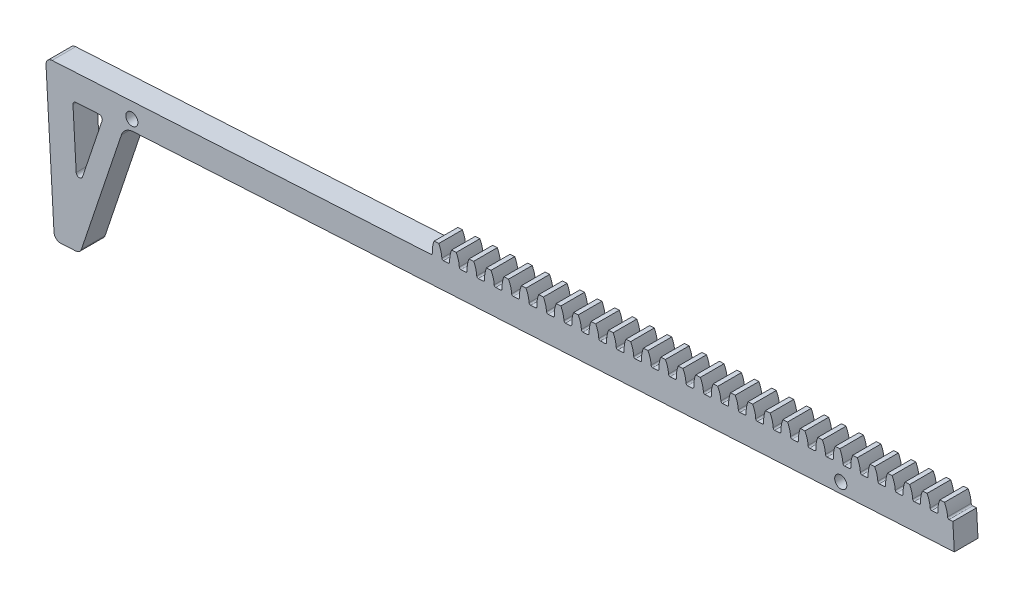
from build123d import *

# Parameters (mm, degrees)
SKETCH1_R                = 24.69999886
SKETCH1_R_2              = 23.39999892
SKETCH1_R_3              = 21.579999004
BOSS_EXTRUDE1_DEPTH      = 2.821
SKETCH8_R                = 7.9375
SKETCH8_R_2              = 1.7526
CUT_EXTRUDE1_DEPTH       = 36.383782321
CUT_EXTRUDE2_DEPTH       = 36.383782321
FILLET3_R                = 0.389999982
CIRPATTERN3_COUNT        = 36
FILLET3_OF_CIRPATTERN3_R = 0.389999982
SKETCH9_R                = 2.994
CUT_EXTRUDE3_DEPTH       = 1.292000064
CHAMFER1_SIZE            = 0.2
BOSS_EXTRUDE2_DEPTH      = 5.842
SKETCH12_R               = 42.047341091
CUT_EXTRUDE4_DEPTH       = 5.642
BOSS_EXTRUDE3_DEPTH      = 5.842
CUT_EXTRUDE5_DEPTH       = 181.609919335
BOSS_EXTRUDE4_DEPTH      = 5.842
FILLET4_R                = 0.79375
FILLET5_R                = 3.175
FILLET6_R                = 1.5875
SKETCH16_R               = 1.5
CUT_EXTRUDE6_DEPTH       = 131.491659985


with BuildPart() as part:
    # Sketch1 → Boss-Extrude1 (new, symmetric)
    # profile 1 of 3: a face of its own
    with BuildSketch(Plane.XY):
        with Locations(Location((0, 0, 0), (0, 0, 180))):
            Circle(SKETCH1_R)
        Circle(SKETCH1_R_2, mode=Mode.SUBTRACT)
    # profile 2 of 3: a face of its own
    with BuildSketch(Plane.XY):
        Circle(SKETCH1_R_2)
        Circle(SKETCH1_R_3, mode=Mode.SUBTRACT)
    # profile 3 of 3: a face of its own
    with BuildSketch(Plane.XY):
        Circle(SKETCH1_R_3)
    extrude(amount=BOSS_EXTRUDE1_DEPTH, both=True)

    # Sketch8 → Cut-Extrude1 (cut, through all)
    with BuildSketch(Plane.XY.offset(2.821)):
        Circle(SKETCH8_R)
        with Locations((0, 13.5)):
            Circle(SKETCH8_R_2)
        with Locations((11.691342951, 6.75)):
            Circle(SKETCH8_R_2)
        with Locations((11.691342951, -6.75)):
            Circle(SKETCH8_R_2)
        with Locations((0, -13.5)):
            Circle(SKETCH8_R_2)
        with Locations((-11.691342951, -6.75)):
            Circle(SKETCH8_R_2)
        with Locations((-11.691342951, 6.75)):
            Circle(SKETCH8_R_2)
    extrude(amount=-CUT_EXTRUDE1_DEPTH, mode=Mode.SUBTRACT)

    # Sketch5 → Cut-Extrude2 (cut, through all)
    with BuildSketch(Plane(origin=(0, 0, 2.821), x_dir=(0.9995316301484097, -0.0306026197058779, 0), z_dir=(0, 0, 1))):
        with BuildLine():
            ThreePointArc((-2.239902489, 25.602202605), (-1.137864495, 23.712913221), (-0.70785597, 21.568386517))
            ThreePointArc((-0.70785597, 21.568386517), (0, 21.579999004), (0.70785597, 21.568386517))
            ThreePointArc((0.70785597, 21.568386517), (1.137864495, 23.712913221), (2.239902489, 25.602202605))
            ThreePointArc((2.239902489, 25.602202605), (0, 25.69999886), (-2.239902489, 25.602202605))
        make_face()
    cut_extrude2 = extrude(amount=-CUT_EXTRUDE2_DEPTH, mode=Mode.SUBTRACT)

    # Fillet3
    fillet3_edges = [part.edges().sort_by_distance(p)[0] for p in [
        (-0.047475301, 21.579946782, 0),
        (1.367573561, 21.536622288, 0),
    ]]
    fillet(fillet3_edges, radius=FILLET3_R)

    # CirPattern3: Cut-Extrude2 ×36 about axis
    cirpattern3_axis = Axis((0, 0, 0), (0, 0, 1))
    for i in range(1, CIRPATTERN3_COUNT):
        add(cut_extrude2.rotate(cirpattern3_axis, i * 360 / CIRPATTERN3_COUNT), mode=Mode.SUBTRACT)

    # Fillet3 of CirPattern3
    fillet3_of_cirpattern3_edges = [part.edges().sort_by_distance(p)[0] for p in [
        (-3.794072477, 21.243854901, 0),
        (-2.392998167, 21.446909259, 0),
        (-7.425388681, 20.262279239, 0),
        (-6.080859858, 20.705542746, 0),
        (-10.831088208, 18.665044475, 0),
        (-9.583957698, 19.335048794, 0),
        (-13.9076906, 16.50068178, 0),
        (-12.795851834, 17.377069168, 0),
        (-16.56171485, 13.834954219, 0),
        (-15.618950486, 14.891096088, 0),
        (-18.712519776, 10.748858574, 0),
        (-17.967475232, 11.95266459, 0),
        (-20.294754257, 7.336164301, 0),
        (-19.770067335, 8.651057426, 0),
        (-21.2603429, 3.700564388, 0),
        (-20.971955946, 5.086592259, 0),
        (-21.579946782, -0.047475301, 0),
        (-21.536622288, 1.367573561, 0),
        (-21.243854901, -3.794072477, 0),
        (-21.446909259, -2.392998167, 0),
        (-20.262279239, -7.425388681, 0),
        (-20.705542746, -6.080859858, 0),
        (-18.665044475, -10.831088208, 0),
        (-19.335048794, -9.583957698, 0),
        (-16.50068178, -13.9076906, 0),
        (-17.377069168, -12.795851834, 0),
        (-13.834954219, -16.56171485, 0),
        (-14.891096088, -15.618950486, 0),
        (-10.748858574, -18.712519776, 0),
        (-11.95266459, -17.967475232, 0),
        (-7.336164301, -20.294754257, 0),
        (-8.651057426, -19.770067335, 0),
        (-3.700564388, -21.2603429, 0),
        (-5.086592259, -20.971955946, 0),
        (0.047475301, -21.579946782, 0),
        (-1.367573561, -21.536622288, 0),
        (3.794072477, -21.243854901, 0),
        (2.392998167, -21.446909259, 0),
        (7.425388681, -20.262279239, 0),
        (6.080859858, -20.705542746, 0),
        (10.831088208, -18.665044475, 0),
        (9.583957698, -19.335048794, 0),
        (13.9076906, -16.50068178, 0),
        (12.795851834, -17.377069168, 0),
        (16.56171485, -13.834954219, 0),
        (15.618950486, -14.891096088, 0),
        (18.712519776, -10.748858574, 0),
        (17.967475232, -11.95266459, 0),
        (20.294754257, -7.336164301, 0),
        (19.770067335, -8.651057426, 0),
        (21.2603429, -3.700564388, 0),
        (20.971955946, -5.086592259, 0),
        (21.579946782, 0.047475301, 0),
        (21.536622288, -1.367573561, 0),
        (21.243854901, 3.794072477, 0),
        (21.446909259, 2.392998167, 0),
        (20.262279239, 7.425388681, 0),
        (20.705542746, 6.080859858, 0),
        (18.665044475, 10.831088208, 0),
        (19.335048794, 9.583957698, 0),
        (16.50068178, 13.9076906, 0),
        (17.377069168, 12.795851834, 0),
        (13.834954219, 16.56171485, 0),
        (14.891096088, 15.618950486, 0),
        (10.748858574, 18.712519776, 0),
        (11.95266459, 17.967475232, 0),
        (7.336164301, 20.294754257, 0),
        (8.651057426, 19.770067335, 0),
        (3.700564388, 21.2603429, 0),
        (5.086592259, 20.971955946, 0),
    ]]
    fillet(fillet3_of_cirpattern3_edges, radius=FILLET3_OF_CIRPATTERN3_R)

    # Sketch9 → Cut-Extrude3 (cut)
    with BuildSketch(Plane.XY.offset(2.821)):
        with Locations((0, 13.5)):
            Circle(SKETCH9_R)
        with Locations((11.691342951, 6.75)):
            Circle(SKETCH9_R)
        with Locations((11.691342951, -6.75)):
            Circle(SKETCH9_R)
        with Locations((0, -13.5)):
            Circle(SKETCH9_R)
        with Locations((-11.691342951, -6.75)):
            Circle(SKETCH9_R)
        with Locations((-11.691342951, 6.75)):
            Circle(SKETCH9_R)
    extrude(amount=-CUT_EXTRUDE3_DEPTH, mode=Mode.SUBTRACT)

    # Chamfer1
    chamfer1_edges = [part.edges().sort_by_distance(p)[0] for p in [
        (-1.7526, 13.5, 1.528999936),
        (9.938742951, 6.75, 1.528999936),
        (9.938742951, -6.75, 1.528999936),
        (-1.7526, -13.5, 1.528999936),
        (-13.443942951, -6.75, 1.528999936),
        (-13.443942951, 6.75, 1.528999936),
        (-7.9375, 0, -2.821),
        (-7.9375, 0, 2.821),
    ]]
    chamfer(chamfer1_edges, length=CHAMFER1_SIZE)

    # Sketch11 → Boss-Extrude2 (add)
    with BuildSketch(Plane.XY.offset(2.821)):
        with BuildLine():
            Line((0.325173702, 21.577548959), (1.541039178, 21.646512572))
            ThreePointArc((1.541039178, 21.646512572), (1.791118876, 21.784119919), (1.880490045, 22.055207417))
            ThreePointArc((1.880490045, 22.055207417), (1.954252523, 23.484659005), (2.331981398, 24.865272508))
            ThreePointArc((2.331981398, 24.865272508), (2.905295017, 24.904486212), (3.479365733, 24.930351886))
            ThreePointArc((3.479365733, 24.930351886), (4.010785921, 23.601305111), (4.245711645, 22.189362247))
            ThreePointArc((4.245711645, 22.189362247), (4.365163046, 21.930119117), (4.629198881, 21.821672286))
            Line((4.629198881, 21.821672286), (5.845064357, 21.890635899))
            ThreePointArc((5.845064357, 21.890635899), (6.095144055, 22.028243246), (6.184515224, 22.299330744))
            ThreePointArc((6.184515224, 22.299330744), (6.258277702, 23.728782333), (6.636006577, 25.109395836))
            ThreePointArc((6.636006577, 25.109395836), (7.209320196, 25.148609539), (7.783390912, 25.174475214))
            ThreePointArc((7.783390912, 25.174475214), (8.3148111, 23.845428438), (8.549736824, 22.433485574))
            ThreePointArc((8.549736824, 22.433485574), (8.669188225, 22.174242445), (8.93322406, 22.065795613))
            Line((8.93322406, 22.065795613), (10.149089536, 22.134759226))
            ThreePointArc((10.149089536, 22.134759226), (10.399169234, 22.272366573), (10.488540403, 22.543454071))
            ThreePointArc((10.488540403, 22.543454071), (10.562302881, 23.97290566), (10.940031756, 25.353519163))
            ThreePointArc((10.940031756, 25.353519163), (11.513345375, 25.392732866), (12.087416091, 25.418598541))
            ThreePointArc((12.087416091, 25.418598541), (12.618836279, 24.089551765), (12.853762003, 22.677608901))
            ThreePointArc((12.853762003, 22.677608901), (12.973213404, 22.418365772), (13.237249239, 22.30991894))
            Line((13.237249239, 22.30991894), (14.453114715, 22.378882553))
            ThreePointArc((14.453114715, 22.378882553), (14.703194413, 22.5164899), (14.792565582, 22.787577398))
            ThreePointArc((14.792565582, 22.787577398), (14.86632806, 24.217028987), (15.244056935, 25.59764249))
            ThreePointArc((15.244056935, 25.59764249), (15.817370554, 25.636856194), (16.39144127, 25.662721868))
            ThreePointArc((16.39144127, 25.662721868), (16.922861458, 24.333675093), (17.157787182, 22.921732228))
            ThreePointArc((17.157787182, 22.921732228), (17.277238583, 22.662489099), (17.541274418, 22.554042268))
            Line((17.541274418, 22.554042268), (18.757139894, 22.62300588))
            ThreePointArc((18.757139894, 22.62300588), (19.007219592, 22.760613227), (19.096590761, 23.031700725))
            ThreePointArc((19.096590761, 23.031700725), (19.170353239, 24.461152314), (19.548082114, 25.841765817))
            ThreePointArc((19.548082114, 25.841765817), (20.121395733, 25.880979521), (20.695466449, 25.906845195))
            ThreePointArc((20.695466449, 25.906845195), (21.226886637, 24.57779842), (21.461812361, 23.165855555))
            ThreePointArc((21.461812361, 23.165855555), (21.581263762, 22.906612426), (21.845299597, 22.798165595))
            Line((21.845299597, 22.798165595), (23.061165073, 22.867129207))
            ThreePointArc((23.061165073, 22.867129207), (23.311244772, 23.004736554), (23.40061594, 23.275824052))
            ThreePointArc((23.40061594, 23.275824052), (23.474378418, 24.705275641), (23.852107293, 26.085889144))
            ThreePointArc((23.852107293, 26.085889144), (24.425420912, 26.125102848), (24.999491628, 26.150968522))
            ThreePointArc((24.999491628, 26.150968522), (25.530911816, 24.821921747), (25.76583754, 23.409978883))
            ThreePointArc((25.76583754, 23.409978883), (25.885288941, 23.150735753), (26.149324776, 23.042288922))
            Line((26.149324776, 23.042288922), (27.365190253, 23.111252534))
            ThreePointArc((27.365190253, 23.111252534), (27.615269951, 23.248859882), (27.704641119, 23.51994738))
            ThreePointArc((27.704641119, 23.51994738), (27.778403597, 24.949398968), (28.156132472, 26.330012471))
            ThreePointArc((28.156132472, 26.330012471), (28.729446091, 26.369226175), (29.303516807, 26.395091849))
            ThreePointArc((29.303516807, 26.395091849), (29.834936995, 25.066045074), (30.069862719, 23.65410221))
            ThreePointArc((30.069862719, 23.65410221), (30.18931412, 23.39485908), (30.453349955, 23.286412249))
            Line((30.453349955, 23.286412249), (31.669215432, 23.355375862))
            ThreePointArc((31.669215432, 23.355375862), (31.91929513, 23.492983209), (32.008666298, 23.764070707))
            ThreePointArc((32.008666298, 23.764070707), (32.082428776, 25.193522295), (32.460157651, 26.574135798))
            ThreePointArc((32.460157651, 26.574135798), (33.03347127, 26.613349502), (33.607541986, 26.639215176))
            ThreePointArc((33.607541986, 26.639215176), (34.138962175, 25.310168401), (34.373887898, 23.898225537))
            ThreePointArc((34.373887898, 23.898225537), (34.493339299, 23.638982407), (34.757375134, 23.530535576))
            Line((34.757375134, 23.530535576), (35.973240611, 23.599499189))
            ThreePointArc((35.973240611, 23.599499189), (36.223320309, 23.737106536), (36.312691477, 24.008194034))
            ThreePointArc((36.312691477, 24.008194034), (36.386453955, 25.437645623), (36.76418283, 26.818259126))
            ThreePointArc((36.76418283, 26.818259126), (37.337496449, 26.857472829), (37.911567165, 26.883338504))
            ThreePointArc((37.911567165, 26.883338504), (38.442987354, 25.554291728), (38.677913077, 24.142348864))
            ThreePointArc((38.677913077, 24.142348864), (38.797364478, 23.883105735), (39.061400313, 23.774658903))
            Line((39.061400313, 23.774658903), (40.27726579, 23.843622516))
            ThreePointArc((40.27726579, 23.843622516), (40.527345488, 23.981229863), (40.616716656, 24.252317361))
            ThreePointArc((40.616716656, 24.252317361), (40.690479134, 25.68176895), (41.068208009, 27.062382453))
            ThreePointArc((41.068208009, 27.062382453), (41.641521628, 27.101596156), (42.215592344, 27.127461831))
            ThreePointArc((42.215592344, 27.127461831), (42.747012533, 25.798415055), (42.981938256, 24.386472191))
            ThreePointArc((42.981938256, 24.386472191), (43.101389657, 24.127229062), (43.365425492, 24.01878223))
            Line((43.365425492, 24.01878223), (44.581290969, 24.087745843))
            ThreePointArc((44.581290969, 24.087745843), (44.831370667, 24.22535319), (44.920741836, 24.496440688))
            ThreePointArc((44.920741836, 24.496440688), (44.994504313, 25.925892277), (45.372233188, 27.30650578))
            ThreePointArc((45.372233188, 27.30650578), (45.945546807, 27.345719484), (46.519617524, 27.371585158))
            ThreePointArc((46.519617524, 27.371585158), (47.051037712, 26.042538383), (47.285963435, 24.630595518))
            ThreePointArc((47.285963435, 24.630595518), (47.405414836, 24.371352389), (47.669450671, 24.262905558))
            Line((47.669450671, 24.262905558), (48.885316148, 24.33186917))
            ThreePointArc((48.885316148, 24.33186917), (49.135395846, 24.469476517), (49.224767015, 24.740564015))
            ThreePointArc((49.224767015, 24.740564015), (49.298529493, 26.170015604), (49.676258367, 27.550629107))
            ThreePointArc((49.676258367, 27.550629107), (50.249571986, 27.589842811), (50.823642703, 27.615708485))
            ThreePointArc((50.823642703, 27.615708485), (51.355062891, 26.28666171), (51.589988614, 24.874718845))
            ThreePointArc((51.589988614, 24.874718845), (51.709440015, 24.615475716), (51.97347585, 24.507028885))
            Line((51.97347585, 24.507028885), (53.189341327, 24.575992497))
            ThreePointArc((53.189341327, 24.575992497), (53.439421025, 24.713599844), (53.528792194, 24.984687342))
            ThreePointArc((53.528792194, 24.984687342), (53.602554672, 26.414138931), (53.980283546, 27.794752434))
            ThreePointArc((53.980283546, 27.794752434), (54.553597165, 27.833966138), (55.127667882, 27.859831812))
            ThreePointArc((55.127667882, 27.859831812), (55.65908807, 26.530785037), (55.894013794, 25.118842173))
            ThreePointArc((55.894013794, 25.118842173), (56.013465195, 24.859599043), (56.27750103, 24.751152212))
            Line((56.27750103, 24.751152212), (57.493366506, 24.820115824))
            ThreePointArc((57.493366506, 24.820115824), (57.743446204, 24.957723172), (57.832817373, 25.22881067))
            ThreePointArc((57.832817373, 25.22881067), (57.906579851, 26.658262258), (58.284308725, 28.038875761))
            ThreePointArc((58.284308725, 28.038875761), (58.857622344, 28.078089465), (59.431693061, 28.103955139))
            ThreePointArc((59.431693061, 28.103955139), (59.963113249, 26.774908364), (60.198038973, 25.3629655))
            ThreePointArc((60.198038973, 25.3629655), (60.317490374, 25.10372237), (60.581526209, 24.995275539))
            Line((60.581526209, 24.995275539), (61.797391685, 25.064239152))
            ThreePointArc((61.797391685, 25.064239152), (62.047471383, 25.201846499), (62.136842552, 25.472933997))
            ThreePointArc((62.136842552, 25.472933997), (62.21060503, 26.902385585), (62.588333904, 28.282999088))
            ThreePointArc((62.588333904, 28.282999088), (63.161647524, 28.322212792), (63.73571824, 28.348078466))
            ThreePointArc((63.73571824, 28.348078466), (64.267138428, 27.019031691), (64.502064152, 25.607088827))
            ThreePointArc((64.502064152, 25.607088827), (64.621515553, 25.347845697), (64.885551388, 25.239398866))
            Line((64.885551388, 25.239398866), (66.101416864, 25.308362479))
            ThreePointArc((66.101416864, 25.308362479), (66.351496562, 25.445969826), (66.440867731, 25.717057324))
            ThreePointArc((66.440867731, 25.717057324), (66.514630209, 27.146508913), (66.892359084, 28.527122416))
            ThreePointArc((66.892359084, 28.527122416), (67.465672703, 28.566336119), (68.039743419, 28.592201794))
            ThreePointArc((68.039743419, 28.592201794), (68.571163607, 27.263155018), (68.806089331, 25.851212154))
            ThreePointArc((68.806089331, 25.851212154), (68.925540732, 25.591969025), (69.189576567, 25.483522193))
            Line((69.189576567, 25.483522193), (70.405442043, 25.552485806))
            ThreePointArc((70.405442043, 25.552485806), (70.655521741, 25.690093153), (70.74489291, 25.961180651))
            ThreePointArc((70.74489291, 25.961180651), (70.818655388, 27.39063224), (71.196384263, 28.771245743))
            ThreePointArc((71.196384263, 28.771245743), (71.769697882, 28.810459446), (72.343768598, 28.836325121))
            ThreePointArc((72.343768598, 28.836325121), (72.875188786, 27.507278345), (73.11011451, 26.095335481))
            ThreePointArc((73.11011451, 26.095335481), (73.229565911, 25.836092352), (73.493601746, 25.72764552))
            Line((73.493601746, 25.72764552), (74.709467222, 25.796609133))
            ThreePointArc((74.709467222, 25.796609133), (74.95954692, 25.93421648), (75.048918089, 26.205303978))
            ThreePointArc((75.048918089, 26.205303978), (75.122680567, 27.634755567), (75.500409442, 29.01536907))
            ThreePointArc((75.500409442, 29.01536907), (76.073723061, 29.054582774), (76.647793777, 29.080448448))
            ThreePointArc((76.647793777, 29.080448448), (77.179213965, 27.751401673), (77.414139689, 26.339458808))
            ThreePointArc((77.414139689, 26.339458808), (77.53359109, 26.080215679), (77.797626925, 25.971768848))
            Line((77.797626925, 25.971768848), (79.013492401, 26.04073246))
            ThreePointArc((79.013492401, 26.04073246), (79.263572099, 26.178339807), (79.352943268, 26.449427305))
            ThreePointArc((79.352943268, 26.449427305), (79.426705746, 27.878878894), (79.804434621, 29.259492397))
            ThreePointArc((79.804434621, 29.259492397), (80.37774824, 29.298706101), (80.951818956, 29.324571775))
            ThreePointArc((80.951818956, 29.324571775), (81.483239144, 27.995525), (81.718164868, 26.583582135))
            ThreePointArc((81.718164868, 26.583582135), (81.837616269, 26.324339006), (82.101652104, 26.215892175))
            Line((82.101652104, 26.215892175), (83.31751758, 26.284855787))
            ThreePointArc((83.31751758, 26.284855787), (83.567597278, 26.422463134), (83.656968447, 26.693550633))
            ThreePointArc((83.656968447, 26.693550633), (83.730730925, 28.123002221), (84.1084598, 29.503615724))
            ThreePointArc((84.1084598, 29.503615724), (84.681773419, 29.542829428), (85.255844135, 29.568695102))
            ThreePointArc((85.255844135, 29.568695102), (85.787264323, 28.239648327), (86.022190047, 26.827705463))
            ThreePointArc((86.022190047, 26.827705463), (86.141641448, 26.568462333), (86.405677283, 26.460015502))
            Line((86.405677283, 26.460015502), (87.621542759, 26.528979115))
            ThreePointArc((87.621542759, 26.528979115), (87.871622457, 26.666586462), (87.960993626, 26.93767396))
            ThreePointArc((87.960993626, 26.93767396), (88.034756104, 28.367125548), (88.412484979, 29.747739051))
            ThreePointArc((88.412484979, 29.747739051), (88.985798598, 29.786952755), (89.559869314, 29.812818429))
            ThreePointArc((89.559869314, 29.812818429), (90.091289502, 28.483771654), (90.326215226, 27.07182879))
            ThreePointArc((90.326215226, 27.07182879), (90.445666627, 26.81258566), (90.709702462, 26.704138829))
            Line((90.709702462, 26.704138829), (91.925567938, 26.773102442))
            ThreePointArc((91.925567938, 26.773102442), (92.175647637, 26.910709789), (92.265018805, 27.181797287))
            ThreePointArc((92.265018805, 27.181797287), (92.338781283, 28.611248875), (92.716510158, 29.991862378))
            ThreePointArc((92.716510158, 29.991862378), (93.289823777, 30.031076082), (93.863894493, 30.056941756))
            ThreePointArc((93.863894493, 30.056941756), (94.395314681, 28.727894981), (94.630240405, 27.315952117))
            ThreePointArc((94.630240405, 27.315952117), (94.749691806, 27.056708987), (95.013727641, 26.948262156))
            Line((95.013727641, 26.948262156), (96.229593117, 27.017225769))
            ThreePointArc((96.229593117, 27.017225769), (96.479672816, 27.154833116), (96.569043984, 27.425920614))
            ThreePointArc((96.569043984, 27.425920614), (96.642806462, 28.855372203), (97.020535337, 30.235985706))
            ThreePointArc((97.020535337, 30.235985706), (97.593848956, 30.275199409), (98.167919672, 30.301065084))
            ThreePointArc((98.167919672, 30.301065084), (98.69933986, 28.972018308), (98.934265584, 27.560075444))
            ThreePointArc((98.934265584, 27.560075444), (99.053716985, 27.300832315), (99.31775282, 27.192385483))
            Line((99.31775282, 27.192385483), (100.533618297, 27.261349096))
            ThreePointArc((100.533618297, 27.261349096), (100.783697995, 27.398956443), (100.873069163, 27.670043941))
            ThreePointArc((100.873069163, 27.670043941), (100.946831641, 29.09949553), (101.324560516, 30.480109033))
            ThreePointArc((101.324560516, 30.480109033), (101.897874135, 30.519322736), (102.471944851, 30.545188411))
            ThreePointArc((102.471944851, 30.545188411), (103.003365039, 29.216141635), (103.238290763, 27.804198771))
            ThreePointArc((103.238290763, 27.804198771), (103.357742164, 27.544955642), (103.621777999, 27.43650881))
            Line((103.621777999, 27.43650881), (104.837643476, 27.505472423))
            ThreePointArc((104.837643476, 27.505472423), (105.087723174, 27.64307977), (105.177094342, 27.914167268))
            ThreePointArc((105.177094342, 27.914167268), (105.25085682, 29.343618857), (105.628585695, 30.72423236))
            ThreePointArc((105.628585695, 30.72423236), (106.201899314, 30.763446064), (106.77597003, 30.789311738))
            ThreePointArc((106.77597003, 30.789311738), (107.307390219, 29.460264963), (107.542315942, 28.048322098))
            ThreePointArc((107.542315942, 28.048322098), (107.661767343, 27.789078969), (107.925803178, 27.680632138))
            Line((107.925803178, 27.680632138), (109.141668655, 27.74959575))
            ThreePointArc((109.141668655, 27.74959575), (109.391748353, 27.887203097), (109.481119521, 28.158290595))
            ThreePointArc((109.481119521, 28.158290595), (109.554881999, 29.587742184), (109.932610874, 30.968355687))
            ThreePointArc((109.932610874, 30.968355687), (110.505924493, 31.007569391), (111.079995209, 31.033435065))
            ThreePointArc((111.079995209, 31.033435065), (111.611415398, 29.70438829), (111.846341121, 28.292445425))
            ThreePointArc((111.846341121, 28.292445425), (111.965792522, 28.033202296), (112.229828357, 27.924755465))
            Line((112.229828357, 27.924755465), (113.445693834, 27.993719077))
            ThreePointArc((113.445693834, 27.993719077), (113.695773532, 28.131326424), (113.7851447, 28.402413923))
            ThreePointArc((113.7851447, 28.402413923), (113.858907178, 29.831865511), (114.236636053, 31.212479014))
            ThreePointArc((114.236636053, 31.212479014), (114.809949672, 31.251692718), (115.384020388, 31.277558392))
            ThreePointArc((115.384020388, 31.277558392), (115.915440577, 29.948511617), (116.1503663, 28.536568753))
            ThreePointArc((116.1503663, 28.536568753), (116.269817701, 28.277325623), (116.533853536, 28.168878792))
            Line((116.533853536, 28.168878792), (117.749719013, 28.237842405))
            ThreePointArc((117.749719013, 28.237842405), (117.999798711, 28.375449752), (118.08916988, 28.64653725))
            ThreePointArc((118.08916988, 28.64653725), (118.162932357, 30.075988838), (118.540661232, 31.456602341))
            ThreePointArc((118.540661232, 31.456602341), (119.113974851, 31.495816045), (119.688045568, 31.521681719))
            ThreePointArc((119.688045568, 31.521681719), (120.219465756, 30.192634944), (120.454391479, 28.78069208))
            ThreePointArc((120.454391479, 28.78069208), (120.57384288, 28.52144895), (120.837878715, 28.413002119))
            Line((120.837878715, 28.413002119), (122.053744192, 28.481965732))
            ThreePointArc((122.053744192, 28.481965732), (122.30382389, 28.619573079), (122.393195059, 28.890660577))
            ThreePointArc((122.393195059, 28.890660577), (122.466957537, 30.320112165), (122.844686411, 31.700725669))
            ThreePointArc((122.844686411, 31.700725669), (123.41800003, 31.739939372), (123.992070747, 31.765805047))
            ThreePointArc((123.992070747, 31.765805047), (124.523490935, 30.436758271), (124.758416658, 29.024815407))
            ThreePointArc((124.758416658, 29.024815407), (124.877868059, 28.765572277), (125.141903895, 28.657125446))
            Line((125.141903895, 28.657125446), (126.357769371, 28.726089059))
            ThreePointArc((126.357769371, 28.726089059), (126.607849069, 28.863696406), (126.697220238, 29.134783904))
            ThreePointArc((126.697220238, 29.134783904), (126.770982716, 30.564235493), (127.14871159, 31.944848996))
            ThreePointArc((127.14871159, 31.944848996), (127.722025209, 31.984062699), (128.296095926, 32.009928374))
            ThreePointArc((128.296095926, 32.009928374), (128.827516114, 30.680881598), (129.062441838, 29.268938734))
            ThreePointArc((129.062441838, 29.268938734), (129.181893239, 29.009695605), (129.445929074, 28.901248773))
            Line((129.445929074, 28.901248773), (130.66179455, 28.970212386))
            ThreePointArc((130.66179455, 28.970212386), (130.911874248, 29.107819733), (131.001245417, 29.378907231))
            ThreePointArc((131.001245417, 29.378907231), (131.075007895, 30.80835882), (131.452736769, 32.188972323))
            ThreePointArc((131.452736769, 32.188972323), (132.026050388, 32.228186026), (132.600121105, 32.254051701))
            ThreePointArc((132.600121105, 32.254051701), (133.131541293, 30.925004925), (133.366467017, 29.513062061))
            ThreePointArc((133.366467017, 29.513062061), (133.485918418, 29.253818932), (133.749954253, 29.1453721))
            Line((133.749954253, 29.1453721), (134.965819729, 29.214335713))
            ThreePointArc((134.965819729, 29.214335713), (135.215899427, 29.35194306), (135.305270596, 29.623030558))
            ThreePointArc((135.305270596, 29.623030558), (135.379033074, 31.052482147), (135.756761948, 32.43309565))
            ThreePointArc((135.756761948, 32.43309565), (136.330075568, 32.472309354), (136.904146284, 32.498175028))
            ThreePointArc((136.904146284, 32.498175028), (137.435566472, 31.169128253), (137.670492196, 29.757185388))
            ThreePointArc((137.670492196, 29.757185388), (137.789943597, 29.497942259), (138.053979432, 29.389495428))
            Line((138.053979432, 29.389495428), (139.269844908, 29.45845904))
            ThreePointArc((139.269844908, 29.45845904), (139.519924606, 29.596066387), (139.609295775, 29.867153885))
            ThreePointArc((139.609295775, 29.867153885), (139.683058253, 31.296605474), (140.060787128, 32.677218977))
            ThreePointArc((140.060787128, 32.677218977), (140.634100747, 32.716432681), (141.208171463, 32.742298355))
            ThreePointArc((141.208171463, 32.742298355), (141.739591651, 31.41325158), (141.974517375, 30.001308715))
            ThreePointArc((141.974517375, 30.001308715), (142.093968776, 29.742065586), (142.358004611, 29.633618755))
            Line((142.358004611, 29.633618755), (143.573870087, 29.702582367))
            ThreePointArc((143.573870087, 29.702582367), (143.823949785, 29.840189715), (143.913320954, 30.111277213))
            ThreePointArc((143.913320954, 30.111277213), (143.987083432, 31.540728801), (144.364812307, 32.921342304))
            ThreePointArc((144.364812307, 32.921342304), (144.938125926, 32.960556008), (145.512196642, 32.986421682))
            ThreePointArc((145.512196642, 32.986421682), (146.04361683, 31.657374907), (146.278542554, 30.245432043))
            ThreePointArc((146.278542554, 30.245432043), (146.397993955, 29.986188913), (146.66202979, 29.877742082))
            Line((146.66202979, 29.877742082), (147.877895266, 29.946705695))
            ThreePointArc((147.877895266, 29.946705695), (148.127974964, 30.084313042), (148.217346133, 30.35540054))
            ThreePointArc((148.217346133, 30.35540054), (148.291108611, 31.784852128), (148.668837486, 33.165465631))
            ThreePointArc((148.668837486, 33.165465631), (149.242151105, 33.204679335), (149.816221821, 33.230545009))
            ThreePointArc((149.816221821, 33.230545009), (150.347642009, 31.901498234), (150.582567733, 30.48955537))
            ThreePointArc((150.582567733, 30.48955537), (150.702019134, 30.23031224), (150.966054969, 30.121865409))
            Line((150.966054969, 30.121865409), (152.181920445, 30.190829022))
            ThreePointArc((152.181920445, 30.190829022), (152.432000143, 30.328436369), (152.521371312, 30.599523867))
            ThreePointArc((152.521371312, 30.599523867), (152.59513379, 32.028975456), (152.972862665, 33.409588959))
            ThreePointArc((152.972862665, 33.409588959), (153.546176284, 33.448802662), (154.120247, 33.474668337))
            ThreePointArc((154.120247, 33.474668337), (154.651667188, 32.145621561), (154.886592912, 30.733678697))
            ThreePointArc((154.886592912, 30.733678697), (155.006044313, 30.474435567), (155.270080148, 30.365988736))
            Line((155.270080148, 30.365988736), (156.485945624, 30.434952349))
            ThreePointArc((156.485945624, 30.434952349), (156.736025322, 30.572559696), (156.825396491, 30.843647194))
            ThreePointArc((156.825396491, 30.843647194), (156.899158969, 32.273098783), (157.276887844, 33.653712286))
            ThreePointArc((157.276887844, 33.653712286), (157.850201463, 33.692925989), (158.424272179, 33.718791664))
            ThreePointArc((158.424272179, 33.718791664), (158.955692367, 32.389744888), (159.190618091, 30.977802024))
            ThreePointArc((159.190618091, 30.977802024), (159.310069492, 30.718558895), (159.574105327, 30.610112063))
            Line((159.574105327, 30.610112063), (160.789970803, 30.679075676))
            ThreePointArc((160.789970803, 30.679075676), (161.040050501, 30.816683023), (161.12942167, 31.087770521))
            ThreePointArc((161.12942167, 31.087770521), (161.203184148, 32.51722211), (161.580913023, 33.897835613))
            ThreePointArc((161.580913023, 33.897835613), (162.154226642, 33.937049316), (162.728297358, 33.962914991))
            ThreePointArc((162.728297358, 33.962914991), (163.259717546, 32.633868215), (163.49464327, 31.221925351))
            ThreePointArc((163.49464327, 31.221925351), (163.614094671, 30.962682222), (163.878130506, 30.85423539))
            Line((163.878130506, 30.85423539), (165.093995982, 30.923199003))
            ThreePointArc((165.093995982, 30.923199003), (165.344075681, 31.06080635), (165.433446849, 31.331893848))
            ThreePointArc((165.433446849, 31.331893848), (165.507209327, 32.761345437), (165.884938202, 34.14195894))
            ThreePointArc((165.884938202, 34.14195894), (166.458251821, 34.181172644), (167.032322537, 34.207038318))
            ThreePointArc((167.032322537, 34.207038318), (167.563742725, 32.877991543), (167.798668449, 31.466048678))
            ThreePointArc((167.798668449, 31.466048678), (167.91811985, 31.206805549), (168.182155685, 31.098358718))
            Line((168.182155685, 31.098358718), (169.398021161, 31.16732233))
            ThreePointArc((169.398021161, 31.16732233), (169.64810086, 31.304929677), (169.737472028, 31.576017175))
            ThreePointArc((169.737472028, 31.576017175), (169.811234506, 33.005468764), (170.188963381, 34.386082267))
            ThreePointArc((170.188963381, 34.386082267), (170.762277, 34.425295971), (171.336347716, 34.451161645))
            ThreePointArc((171.336347716, 34.451161645), (171.867767904, 33.12211487), (172.102693628, 31.710172005))
            ThreePointArc((172.102693628, 31.710172005), (172.222145029, 31.450928876), (172.486180864, 31.342482045))
            Line((172.486180864, 31.342482045), (173.702046341, 31.411445657))
            ThreePointArc((173.702046341, 31.411445657), (173.952126039, 31.549053005), (174.041497207, 31.820140503))
            ThreePointArc((174.041497207, 31.820140503), (174.115259685, 33.249592091), (174.49298856, 34.630205594))
            ThreePointArc((174.49298856, 34.630205594), (175.066302179, 34.669419298), (175.640372895, 34.695284972))
            ThreePointArc((175.640372895, 34.695284972), (176.171793084, 33.366238197), (176.406718807, 31.954295333))
            ThreePointArc((176.406718807, 31.954295333), (176.526170208, 31.695052203), (176.790206043, 31.586605372))
            Line((176.790206043, 31.586605372), (177.149798632, 25.24679519))
            Line((177.149798632, 25.24679519), (-2.403393412, 15.06257906))
            Line((-2.403393412, 15.06257906), (-2.762986001, 21.402389244))
            ThreePointArc((-2.762986001, 21.402389244), (-2.512906303, 21.539996592), (-2.423535134, 21.81108409))
            ThreePointArc((-2.423535134, 21.81108409), (-2.349772656, 23.240535678), (-1.972043781, 24.621149181))
            ThreePointArc((-1.972043781, 24.621149181), (-1.398730162, 24.660362885), (-0.824659446, 24.686228559))
            ThreePointArc((-0.824659446, 24.686228559), (-0.293239258, 23.357181784), (-0.058313534, 21.94523892))
            ThreePointArc((-0.058313534, 21.94523892), (0.061137867, 21.68599579), (0.325173702, 21.577548959))
        make_face()
    extrude(amount=BOSS_EXTRUDE2_DEPTH)

    # Sketch12 → Cut-Extrude4 (cut)
    with BuildSketch(Plane(origin=(0, 0, -2.821), x_dir=(-1, 0, 0), z_dir=(0, 0, -1))):
        Circle(SKETCH12_R)
    extrude(amount=-CUT_EXTRUDE4_DEPTH, mode=Mode.SUBTRACT)

    # Sketch13 → Boss-Extrude3 (add)
    with BuildSketch(Plane.XY.offset(8.663)):
        Polygon((-97.860138762, 16.008500414), (-2.762986001, 21.402389244), (-2.403393412, 15.06257906), (-97.500546173, 9.66869023), align=None)
    extrude(amount=-BOSS_EXTRUDE3_DEPTH)

    # Sketch14 → Cut-Extrude5 (cut, through all)
    with BuildSketch(Plane(origin=(0, 0, 2.821), x_dir=(-1, 0, 0), z_dir=(0, 0, -1))):
        Polygon((-127.969934751, -4.756598811), (-125.060690075, 46.53494502), (-196.101011215, 46.53494502), (-194.967405476, 24.771760222), align=None)
    extrude(amount=-CUT_EXTRUDE5_DEPTH, mode=Mode.SUBTRACT)

    # Sketch15 → Boss-Extrude4 (add)
    with BuildSketch(Plane(origin=(0, 0, 2.821), x_dir=(-1, 0, 0), z_dir=(0, 0, -1))):
        Polygon((97.500546173, 9.66869023), (91.160735989, 10.028282819), (90.081958223, -8.991147734), (83.552963768, 10.459793925), (78.481115621, 10.747467996), (89.362773046, -21.670768102), (95.70258323, -22.030360691), align=None)
    extrude(amount=-BOSS_EXTRUDE4_DEPTH)

    # Fillet4
    fillet4_edges = [part.edges().sort_by_distance(p)[0] for p in [
        (-91.160735989, 10.028282819, 5.742),
        (-90.081958223, -8.991147734, 5.742),
        (-83.552963768, 10.459793925, 5.742),
    ]]
    fillet(fillet4_edges, radius=FILLET4_R)

    # Fillet5
    fillet5_edges = [part.edges().sort_by_distance(p)[0] for p in [
        (-78.481115621, 10.747467996, 5.742),
    ]]
    fillet(fillet5_edges, radius=FILLET5_R)

    # Fillet6
    fillet6_edges = [part.edges().sort_by_distance(p)[0] for p in [
        (-97.860138762, 16.008500414, 5.742),
        (-89.362773046, -21.670768102, 5.742),
        (-95.70258323, -22.030360691, 5.742),
    ]]
    fillet(fillet6_edges, radius=FILLET6_R)

    # Sketch16 → Cut-Extrude6 (cut, through all)
    with BuildSketch(Plane(origin=(0, 0, 2.821), x_dir=(-1, 0, 0), z_dir=(0, 0, -1))):
        with Locations((-98.392315314, 23.323771164)):
            Circle(SKETCH16_R)
        with Locations((76.586445767, 13.399015716)):
            Circle(SKETCH16_R)
    extrude(amount=-CUT_EXTRUDE6_DEPTH, mode=Mode.SUBTRACT)


solid = part.part
